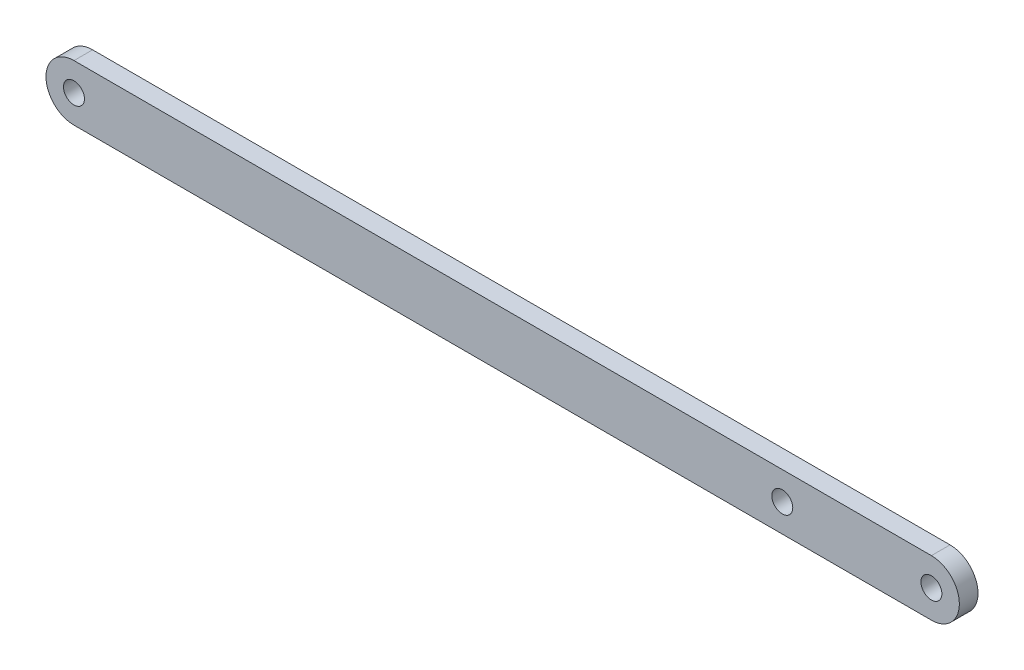
from build123d import *

# Parameters (mm, degrees)
BOSS_EXTRUDE1_DEPTH             = 3.175
F_9_64_0_14063_DIAMETER_HOLE1_D = 3.572002
BOSS_EXTRUDE2_START             = -3.175
BOSS_EXTRUDE2_DEPTH             = 3.175
F_9_64_0_14063_DIAMETER_HOLE2_D = 3.572002


with BuildPart() as part:
    # Sketch1 → Boss-Extrude1 (new body)
    with BuildSketch(Plane.XY):
        with BuildLine():
            Line((0, -4.7625), (-120.65, -4.7625))
            ThreePointArc((-120.65, -4.7625), (-125.4125, 0), (-120.65, 4.7625))
            Line((-120.65, 4.7625), (0, 4.7625))
            ThreePointArc((0, 4.7625), (4.7625, 0), (0, -4.7625))
        make_face()
    extrude(amount=BOSS_EXTRUDE1_DEPTH)

    # 9/64 (0.14063) Diameter Hole1 (through all)
    with Locations(Plane.XY.offset(3.175)):
        with Locations((0, 0), (-120.65, 0)):
            Hole(F_9_64_0_14063_DIAMETER_HOLE1_D / 2)

    # Sketch4 → Boss-Extrude2 (add)
    with BuildSketch(Plane.XY.offset(3.175).offset(BOSS_EXTRUDE2_START)):
        with BuildLine():
            Line((25.4, 4.7625), (0, 4.7625))
            ThreePointArc((0, 4.7625), (4.7625, 0), (0, -4.7625))
            Line((0, -4.7625), (25.4, -4.7625))
            ThreePointArc((25.4, -4.7625), (30.1625, 0), (25.4, 4.7625))
        make_face()
    extrude(amount=BOSS_EXTRUDE2_DEPTH)

    # 9/64 (0.14063) Diameter Hole2 (through all)
    with Locations(Plane.XY.offset(3.175)):
        with Locations((25.4, 0)):
            Hole(F_9_64_0_14063_DIAMETER_HOLE2_D / 2)


solid = part.part
